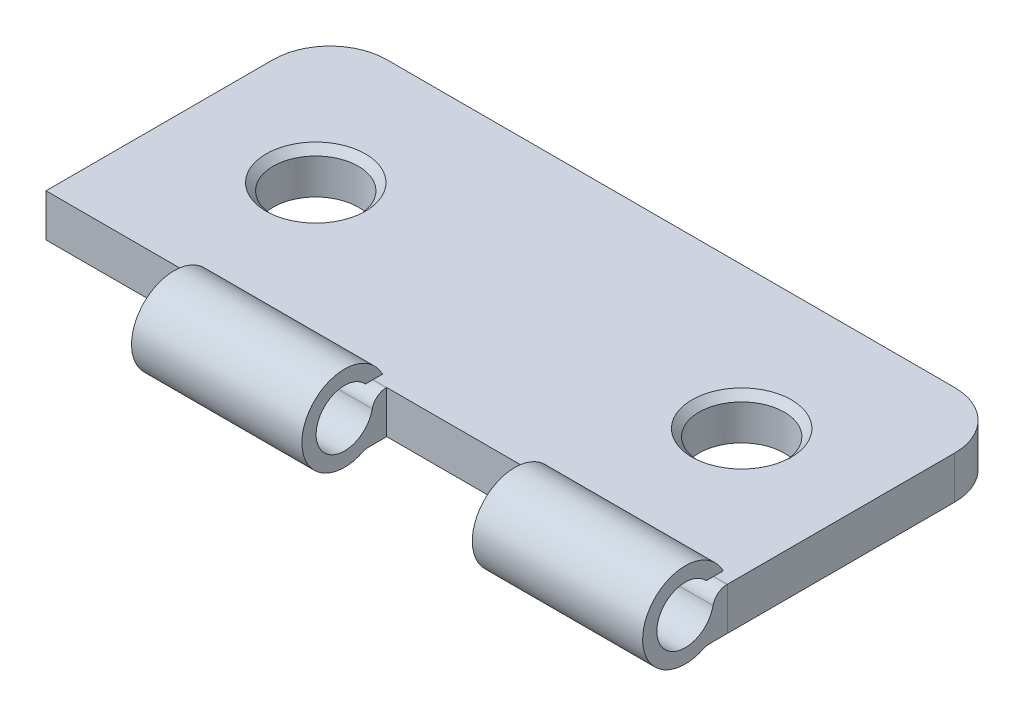
from build123d import *

# Parameters (mm, degrees)
SKETCH1_R           = 1.5
BOSS_EXTRUDE1_DEPTH = 1.5
BOSS_EXTRUDE2_DEPTH = 6
LPATTERN1_COUNT     = 2
LPATTERN1_PITCH     = 12
CHAMFER1_SIZE       = 0.25


with BuildPart() as part:
    # Sketch1 → Boss-Extrude1 (new body)
    with BuildSketch(Plane(origin=(0, 0, 0), x_dir=(1, 0, 0), z_dir=(0, 1, 0))):
        with BuildLine():
            Line((-12, -5), (12, -5))
            Line((12, -5), (12, 3))
            ThreePointArc((12, 3), (11.414213562, 4.414213562), (10, 5))
            Line((10, 5), (-10, 5))
            ThreePointArc((-10, 5), (-11.414213562, 4.414213562), (-12, 3))
            Line((-12, 3), (-12, -5))
        make_face()
        with Locations((-7.5, 0)):
            Circle(SKETCH1_R, mode=Mode.SUBTRACT)
        with Locations((7.5, 0)):
            Circle(SKETCH1_R, mode=Mode.SUBTRACT)
    extrude(amount=BOSS_EXTRUDE1_DEPTH)

    # Chamfer1
    chamfer1_edges = [part.edges().sort_by_distance(p)[0] for p in [
        (6, 1.5, 0),
        (-9, 1.5, 0),
    ]]
    chamfer(chamfer1_edges, length=CHAMFER1_SIZE)


with BuildPart() as body_2:
    # Sketch2 → Boss-Extrude2 (new body)
    with BuildSketch(Plane(origin=(12, 0, 0), x_dir=(0, 0, -1), z_dir=(1, 0, 0))):
        with BuildLine():
            ThreePointArc((-5.508510281, 1.102098283), (-7.451972999, 1.042331862), (-5.748904302, 1.980509015))
            Line((-5.748904302, 1.980509015), (-5.147501661, 1.980509015))
            ThreePointArc((-5.147501661, 1.980509015), (-7.906293074, 1.792973888), (-5.843444347, -0.048426288))
            ThreePointArc((-5.843444347, -0.048426288), (-5.738808935, -0.012256801), (-5.628779066, 0))
            Line((-5.628779066, 0), (-5, 0))
            Line((-5, 0), (-5, 1.112589695))
            Line((-5, 1.112589695), (-5, 1.5))
            Line((-5, 1.5), (-5.019045328, 1.5))
            ThreePointArc((-5.019045328, 1.5), (-5.334442584, 1.387974961), (-5.508510281, 1.102098283))
        make_face()
    boss_extrude2 = extrude(amount=-BOSS_EXTRUDE2_DEPTH)


with BuildPart() as lpattern1_1:
    # LPattern1: Boss-Extrude2 ×2
    with Locations(*[(-i * LPATTERN1_PITCH, 0, 0) for i in range(1, LPATTERN1_COUNT)]):
        add(boss_extrude2)


solid = Compound([part.part, body_2.part, lpattern1_1.part])
